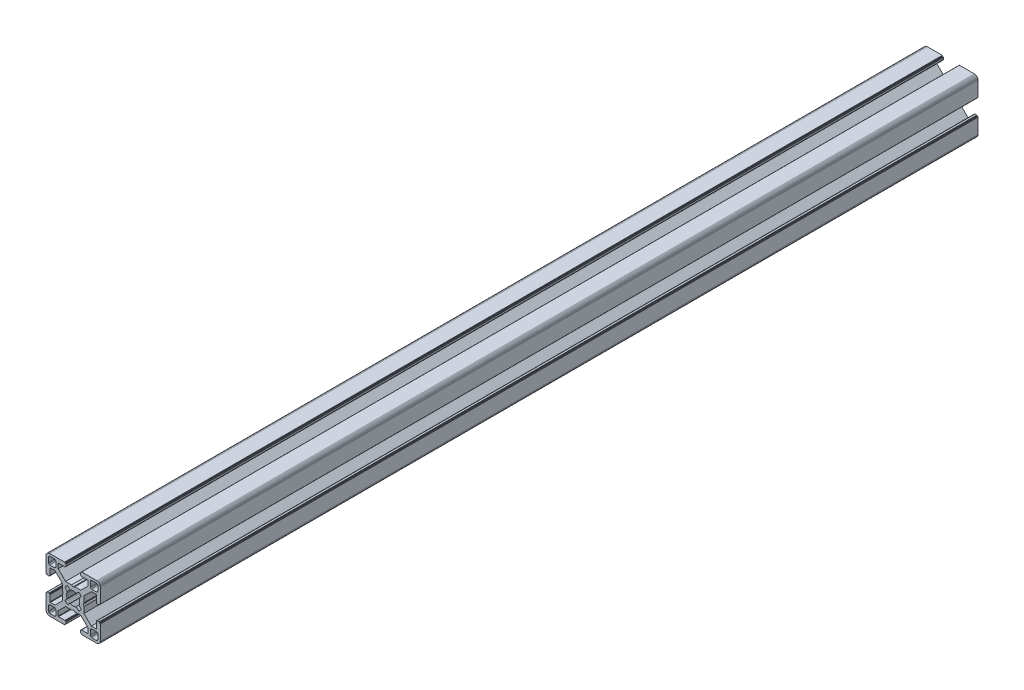
from build123d import *

# Parameters (mm, degrees)
BOSS_EXTRUDE1_DEPTH = 485


with BuildPart() as part:
    # Sketch1 → Boss-Extrude1 (new body)
    with BuildSketch(Plane.XY):
        Polygon((28.34729664, 29.969613999), (28.000000864, 29.999999329), (19.750000909, 29.999999329), (19.715268165, 29.996961355), (19.681595266, 29.987938702), (19.649999216, 29.973205179), (19.621443003, 29.953207821), (19.596790895, 29.928557575), (19.576793537, 29.899999499), (19.562061876, 29.868405312), (19.55303736, 29.834728688), (19.549999386, 29.799999669), (19.549999386, 29.699999839), (19.546961412, 29.665268958), (19.537936896, 29.631596059), (19.523203373, 29.599998146), (19.503207877, 29.571441934), (19.478557631, 29.546789825), (19.449999556, 29.526794329), (19.418403506, 29.512060806), (19.384728745, 29.503038153), (19.349999726, 29.500000179), (19.249999896, 29.500000179), (19.215267517, 29.496958527), (19.181592755, 29.487935874), (19.149996706, 29.47320235), (19.12143863, 29.453206855), (19.096788384, 29.428554746), (19.076791026, 29.399996671), (19.062057503, 29.368402484), (19.05303485, 29.334725859), (19.049996876, 29.299998703), (19.049996876, 28.39999837), (19.059110798, 28.29580945), (19.08618062, 28.194785165), (19.13038119, 28.099997016), (19.190369539, 28.014324653), (19.264324002, 27.94037019), (19.349996366, 27.88038184), (19.444784515, 27.836181271), (19.545806937, 27.809111449), (19.650010894, 27.799984574), (23.050010706, 27.799984574), (23.084741588, 27.7969466), (23.118414487, 27.787923946), (23.150012399, 27.773190423), (23.178568612, 27.753193065), (23.203220721, 27.728542819), (23.223218079, 27.699984744), (23.237949739, 27.668386831), (23.246974255, 27.634713932), (23.25001142, 27.59998608), (23.25001142, 25.049987618), (19.204474482, 20.999982084), (15.900007876, 20.999982084), (15.000008474, 20.48483404), (14.10000814, 20.999982084), (10.795543398, 20.999982084), (7.997342887, 23.801274731), (6.750011387, 25.049984589), (6.750011387, 27.599983051), (6.753049362, 27.634713932), (6.762072946, 27.668386831), (6.776805538, 27.699984744), (6.796801965, 27.728542819), (6.821454073, 27.753193065), (6.850011218, 27.773190423), (6.881607267, 27.787923946), (6.915282029, 27.7969466), (6.950011048, 27.799984574), (10.350011791, 27.799984574), (10.45420071, 27.809098497), (10.555223133, 27.836168318), (10.650011282, 27.880368888), (10.735683645, 27.940357238), (10.809638108, 28.014311701), (10.869626458, 28.099984064), (10.913827027, 28.194772213), (10.940895918, 28.295796498), (10.950010772, 28.399985417), (10.950010772, 29.299985751), (10.946974575, 29.334739239), (10.93795065, 29.368415522), (10.923215933, 29.400009153), (10.903218427, 29.428566473), (10.878566319, 29.45321765), (10.849999264, 29.473204166), (10.818403214, 29.487937689), (10.784728453, 29.496960342), (10.749999434, 29.500000179), (10.649999604, 29.500000179), (10.615270585, 29.503038153), (10.581595823, 29.512060806), (10.549999774, 29.526794329), (10.521441698, 29.546789825), (10.496791452, 29.571441934), (10.476795025, 29.599998146), (10.462061502, 29.631596059), (10.453037918, 29.665268958), (10.449999943, 29.699999839), (10.449999943, 29.799999669), (10.446961969, 29.834728688), (10.437938385, 29.868405312), (10.423205793, 29.899999499), (10.403208435, 29.928557575), (10.378557257, 29.953207821), (10.350000113, 29.973205179), (10.318404064, 29.987938702), (10.284729302, 29.996961355), (10.250000283, 29.999999329), (1.999999397, 29.999999329), (1.652702689, 29.969613999), (1.315958682, 29.879383743), (0.999999233, 29.732050374), (0.714424066, 29.532089829), (0.467910431, 29.285576195), (0.267948955, 28.999999166), (0.120614655, 28.684040532), (0.030384399, 28.34729664), (0, 28.000000864), (0, 19.750000909), (0.003037974, 19.715268165), (0.012061559, 19.681595266), (0.026795082, 19.649999216), (0.046790577, 19.621441141), (0.071442686, 19.596789032), (0.09999983, 19.576793537), (0.13159588, 19.562060013), (0.165270641, 19.55303736), (0.19999966, 19.549999386), (0.299999461, 19.549999386), (0.334728509, 19.546959549), (0.368403242, 19.537936896), (0.399999321, 19.523203373), (0.428556465, 19.503207877), (0.453208573, 19.478555769), (0.473204069, 19.449997693), (0.487937592, 19.418403506), (0.496961176, 19.384728745), (0.499999151, 19.349999726), (0.499999151, 19.249998033), (0.503038056, 19.215269014), (0.512060709, 19.181594253), (0.526794232, 19.150000066), (0.546790194, 19.121441524), (0.571441837, 19.096789882), (0.60000029, 19.076794925), (0.631595686, 19.062061999), (0.665270619, 19.053039982), (0.700000626, 19.050000801), (1.60000096, 19.050000801), (1.704189879, 19.059116587), (1.805213233, 19.086186409), (1.90000045, 19.130385115), (1.985673745, 19.190375328), (2.059627277, 19.264327928), (2.119616325, 19.350002154), (2.163816196, 19.444788441), (2.190886018, 19.545812726), (2.200000872, 19.650001645), (2.200000872, 23.050001457), (2.203039777, 23.084732338), (2.212062431, 23.118405237), (2.226795954, 23.15000315), (2.246792381, 23.178559362), (2.271443558, 23.203211471), (2.300000702, 23.223206967), (2.331596752, 23.23794049), (2.365271513, 23.246965006), (2.400001464, 23.250001117), (4.950000857, 23.250001117), (7.997332093, 20.202670812), (8.995535423, 19.204467788), (8.995535423, 15.900001182), (9.515148227, 15.00000178), (8.995535423, 14.100002378), (8.995535423, 10.795536704), (4.950000857, 6.750002138), (2.400001464, 6.750002138), (2.365271513, 6.753040112), (2.331596752, 6.762063697), (2.300000702, 6.77679722), (2.271443558, 6.796793647), (2.246792381, 6.821444824), (2.226795954, 6.850001968), (2.212062431, 6.881598018), (2.203039777, 6.915272779), (2.200000872, 6.950002729), (2.200000872, 10.350002542), (2.190896812, 10.454174265), (2.16382699, 10.555197618), (2.119627119, 10.649984836), (2.059638071, 10.735658131), (1.985684539, 10.809611663), (1.900011244, 10.869600944), (1.805224027, 10.913800582), (1.704200673, 10.940870404), (1.600011754, 10.949986189), (0.70001142, 10.949986189), (0.665281355, 10.946948596), (0.631606253, 10.937926283), (0.600010578, 10.923193954), (0.571451747, 10.903199537), (0.546799638, 10.87854836), (0.526794232, 10.850000195), (0.512060709, 10.818404146), (0.503038056, 10.784730315), (0.499999151, 10.750000365), (0.499999151, 10.650000535), (0.496961176, 10.615270585), (0.487937592, 10.581596754), (0.473204069, 10.550000705), (0.453208573, 10.521443561), (0.428556465, 10.496791452), (0.399999321, 10.476795956), (0.368403242, 10.462062433), (0.334728509, 10.453038849), (0.299999461, 10.449999943), (0.19999966, 10.449999943), (0.165270641, 10.446961969), (0.13159588, 10.437939316), (0.09999983, 10.423205793), (0.071442686, 10.403209366), (0.046790577, 10.378558189), (0.026795082, 10.350000113), (0.012061559, 10.318404064), (0.003037974, 10.284729302), (0, 10.250000283), (0, 1.999999397), (0.030384399, 1.652702689), (0.120614655, 1.315958682), (0.267948955, 0.999999233), (0.467910431, 0.714424066), (0.714424066, 0.467910431), (0.999999233, 0.267948955), (1.315958682, 0.120614655), (1.652702689, 0.030384399), (1.999999397, 0), (10.250000283, 0), (10.284729302, 0.003037974), (10.318404064, 0.012061559), (10.350000113, 0.026795082), (10.378557257, 0.046790577), (10.403208435, 0.071442686), (10.423205793, 0.09999983), (10.437938385, 0.13159588), (10.446961969, 0.165270641), (10.449999943, 0.19999966), (10.449999943, 0.300000422), (10.453037918, 0.334729441), (10.462061502, 0.368404202), (10.476795025, 0.400000252), (10.496791452, 0.428557396), (10.521441698, 0.453208573), (10.549999774, 0.473205), (10.581595823, 0.487938523), (10.615270585, 0.496961176), (10.649999604, 0.500000082), (10.749999434, 0.500000082), (10.784728453, 0.503038056), (10.818403214, 0.512060709), (10.849999264, 0.526794232), (10.878547894, 0.546800104), (10.903198606, 0.571451747), (10.923194493, 0.6000102), (10.93792742, 0.631606528), (10.946949437, 0.66528146), (10.950010772, 0.699984975), (10.950010772, 1.599985308), (10.940895918, 1.704174228), (10.913827027, 1.805197581), (10.869626458, 1.89998573), (10.809638108, 1.985658094), (10.735683645, 2.059612557), (10.650011282, 2.119600674), (10.555223133, 2.163801476), (10.45420071, 2.190870367), (10.350011791, 2.199985221), (6.950011048, 2.199985221), (6.915282029, 2.203024126), (6.881607267, 2.212046779), (6.850011218, 2.226780302), (6.821454073, 2.246776729), (6.796801965, 2.271427907), (6.776805538, 2.299985982), (6.762072946, 2.331582032), (6.753049362, 2.365256793), (6.750011387, 2.399985812), (6.750011387, 4.949985206), (9.787457566, 7.990785077), (10.795545277, 8.999985833), (14.100010019, 8.999985833), (15.000010353, 9.515133877), (15.900009756, 8.999985833), (19.204476361, 8.999985833), (20.21256413, 7.990786065), (23.25001142, 4.949988235), (23.25001142, 2.399988841), (23.246974255, 2.365256793), (23.237949739, 2.331582032), (23.223218079, 2.299985982), (23.203220721, 2.271427907), (23.178568612, 2.246776729), (23.150012399, 2.226780302), (23.118414487, 2.212046779), (23.084741588, 2.203024126), (23.050010706, 2.199985221), (19.650010894, 2.199985221), (19.545806937, 2.190883319), (19.444784515, 2.163814428), (19.349996366, 2.119613626), (19.264324002, 2.059625509), (19.190369539, 1.985671046), (19.13038119, 1.899998682), (19.08618062, 1.805210533), (19.059110798, 1.70418718), (19.049996876, 1.599998261), (19.049996876, 0.699997927), (19.053035506, 0.665268966), (19.062058795, 0.631594374), (19.076792915, 0.599998603), (19.096790813, 0.571440905), (19.121441524, 0.546790194), (19.149999978, 0.526794306), (19.181596306, 0.51206138), (19.215271238, 0.503039363), (19.249999896, 0.500000082), (19.349999726, 0.500000082), (19.384728745, 0.496961176), (19.418403506, 0.487938523), (19.449999556, 0.473205), (19.478557631, 0.453208573), (19.503207877, 0.428557396), (19.523203373, 0.400000252), (19.537936896, 0.368404202), (19.546961412, 0.334729441), (19.549999386, 0.300000422), (19.549999386, 0.19999966), (19.55303736, 0.165270641), (19.562061876, 0.13159588), (19.576793537, 0.09999983), (19.596789964, 0.071441755), (19.621442072, 0.046789646), (19.649998285, 0.02679415), (19.681594335, 0.012060627), (19.715267234, 0.003037043), (19.750000909, 0), (28.000000864, 0), (28.34729664, 0.030384399), (28.684040532, 0.120614655), (28.999999166, 0.267948955), (29.285576195, 0.467910431), (29.532089829, 0.714424066), (29.732050374, 0.999999233), (29.879383743, 1.315958682), (29.969613999, 1.652702689), (29.999999329, 1.999999397), (29.999999329, 10.250000283), (29.996974806, 10.284715361), (29.987951516, 10.318389952), (29.973217396, 10.349985723), (29.953219499, 10.378543421), (29.928568787, 10.403194133), (29.899999499, 10.423205793), (29.868405312, 10.437939316), (29.834728688, 10.446961969), (29.799999669, 10.449999943), (29.699999839, 10.449999943), (29.664909937, 10.453400043), (29.631233313, 10.462423628), (29.599637263, 10.477157151), (29.57108105, 10.497152646), (29.546427079, 10.521804755), (29.526433446, 10.550361899), (29.511699923, 10.581957949), (29.502675407, 10.615631779), (29.499637433, 10.650361729), (29.499637433, 10.750361559), (29.49697202, 10.784715548), (29.487949367, 10.818389378), (29.473215844, 10.849985428), (29.453220348, 10.878542572), (29.428568239, 10.90319468), (29.400010164, 10.923190176), (29.368415977, 10.937923699), (29.334741215, 10.946947284), (29.300012197, 10.949986189), (28.400011863, 10.949986189), (28.29581215, 10.9408876), (28.194787865, 10.913817778), (28.099999716, 10.86961814), (28.014327352, 10.809628859), (27.940374752, 10.735675327), (27.880384539, 10.650002032), (27.836185833, 10.555214814), (27.809114148, 10.454191461), (27.800000225, 10.350002542), (27.800000225, 6.950002729), (27.796962251, 6.915272779), (27.787939598, 6.881598018), (27.773206075, 6.850001968), (27.753208716, 6.821444824), (27.728558471, 6.796793647), (27.700000395, 6.77679722), (27.668404345, 6.762063697), (27.634729584, 6.753040112), (27.599998702, 6.750002138), (25.05000024, 6.750002138), (23.809199132, 7.99080223), (21.004464477, 10.795534588), (21.004464477, 14.100000262), (20.484851673, 14.999999665), (21.004464477, 15.899999067), (21.004464477, 19.204465672), (25.05000024, 23.250001117), (27.599998702, 23.250001117), (27.634729584, 23.246965006), (27.668404345, 23.23794049), (27.700000395, 23.223206967), (27.728558471, 23.203211471), (27.753208716, 23.178559362), (27.773206075, 23.15000315), (27.787939598, 23.118405237), (27.796962251, 23.084732338), (27.800000225, 23.050001457), (27.800000225, 19.650001645), (27.809114148, 19.545812726), (27.836185833, 19.444788441), (27.880384539, 19.350002154), (27.940370508, 19.264323684), (28.014323108, 19.190371084), (28.099995472, 19.130380872), (28.194783621, 19.086182165), (28.295807906, 19.059112343), (28.400001069, 19.050000801), (29.300001402, 19.050000801), (29.334730421, 19.053040638), (29.368405183, 19.062063291), (29.39999937, 19.076796814), (29.42819671, 19.097149726), (29.452848353, 19.1218023), (29.472843309, 19.150360754), (29.487576235, 19.181955219), (29.496598252, 19.215630151), (29.499637433, 19.250359227), (29.499637433, 19.35036092), (29.502675407, 19.385089939), (29.511699923, 19.4187647), (29.526433446, 19.450358887), (29.546427079, 19.478916963), (29.57108105, 19.503569071), (29.599637263, 19.523564567), (29.631233313, 19.53829809), (29.664909937, 19.547320743), (29.699999839, 19.549999386), (29.799999669, 19.549999386), (29.834728688, 19.55303736), (29.868405312, 19.562060013), (29.899999499, 19.576793537), (29.928557575, 19.596789032), (29.953207821, 19.621441141), (29.973205179, 19.649999216), (29.987938702, 19.681595266), (29.996961355, 19.715268165), (29.999999329, 19.750000909), (29.999999329, 28.000000864), (29.969613999, 28.34729664), (29.879383743, 28.684040532), (29.732050374, 28.999999166), (29.532089829, 29.285576195), (29.285576195, 29.532089829), (28.999999166, 29.732050374), (28.684040532, 29.879383743), align=None)
        Polygon((1.299998723, 25.499999523), (1.299998723, 27.699999511), (1.312309876, 27.856435627), (1.348942518, 28.009016067), (1.408992335, 28.153989464), (1.490981318, 28.287785128), (1.592892222, 28.407108039), (1.71221327, 28.50901708), (1.846008119, 28.591006994), (1.9909814, 28.651056811), (2.143563703, 28.687689453), (2.299998887, 28.699999675), (4.499998875, 28.699999675), (4.656434059, 28.687689453), (4.809016362, 28.651056811), (4.953989759, 28.591006994), (5.087784491, 28.50901708), (5.207106471, 28.407108039), (5.309016444, 28.287785128), (5.391005427, 28.153989464), (5.451056175, 28.009016067), (5.487687886, 27.856435627), (5.499999039, 27.699999511), (5.499999039, 25.499999523), (5.487687886, 25.34356527), (5.451056175, 25.190982968), (5.391005427, 25.04600957), (5.309016444, 24.912213907), (5.207106471, 24.792892858), (5.087784491, 24.690981954), (4.953989759, 24.60899204), (4.809016362, 24.548944086), (4.656434059, 24.512309581), (4.499998875, 24.499999359), (2.299998887, 24.499999359), (2.143563703, 24.512309581), (1.9909814, 24.548944086), (1.846008119, 24.60899204), (1.71221327, 24.690981954), (1.592892222, 24.792892858), (1.490981318, 24.912213907), (1.408992335, 25.04600957), (1.348942518, 25.190982968), (1.312309876, 25.34356527), align=None, mode=Mode.SUBTRACT)
        Polygon((25.34356527, 28.687689453), (25.499999523, 28.699999675), (27.699999511, 28.699999675), (27.856435627, 28.687689453), (28.009017929, 28.651056811), (28.153991327, 28.591006994), (28.28778699, 28.50901708), (28.407108039, 28.407108039), (28.50901708, 28.287785128), (28.591006994, 28.153989464), (28.651056811, 28.009016067), (28.687689453, 27.856435627), (28.700001538, 27.699999511), (28.700001538, 25.499999523), (28.687689453, 25.34356527), (28.651056811, 25.190982968), (28.591006994, 25.04600957), (28.50901708, 24.912213907), (28.407108039, 24.792892858), (28.28778699, 24.690981954), (28.153991327, 24.60899204), (28.009017929, 24.548944086), (27.856435627, 24.512309581), (27.699999511, 24.499999359), (25.499999523, 24.499999359), (25.34356527, 24.512309581), (25.190982968, 24.548944086), (25.04600957, 24.60899204), (24.912215769, 24.690981954), (24.792892858, 24.792892858), (24.690981954, 24.912213907), (24.608993903, 25.04600957), (24.548944086, 25.190982968), (24.512311444, 25.34356527), (24.500001222, 25.499999523), (24.500001222, 27.699999511), (24.512311444, 27.856435627), (24.548944086, 28.009016067), (24.608993903, 28.153989464), (24.690981954, 28.287785128), (24.792892858, 28.407108039), (24.912215769, 28.50901708), (25.04600957, 28.591006994), (25.190982968, 28.651056811), align=None, mode=Mode.SUBTRACT)
        Polygon((14.999999665, 18.649999052), (15.550030395, 18.608318642), (16.087498516, 18.484227359), (16.600128263, 18.280562013), (18.13592948, 19.518401474), (18.644984812, 19.11874488), (19.103571773, 18.662061542), (19.505336881, 18.154669553), (18.280562013, 16.600130126), (18.484227359, 16.087498516), (18.608318642, 15.550030395), (18.649999052, 14.999999665), (18.608318642, 14.449968934), (18.484227359, 13.912500814), (18.280562013, 13.399870135), (19.505336881, 11.845329776), (19.103571773, 11.337937787), (18.644984812, 10.881252587), (18.13592948, 10.481598787), (16.600128263, 11.719437316), (16.087498516, 11.515771039), (15.550030395, 11.391680688), (14.999999665, 11.349999346), (14.449968934, 11.391680688), (13.912500814, 11.515771039), (13.399870135, 11.719437316), (11.864069849, 10.481598787), (11.355013587, 10.881252587), (10.896427557, 11.337937787), (10.494662449, 11.845329776), (11.719438247, 13.399870135), (11.515771039, 13.912500814), (11.391680688, 14.449968934), (11.349999346, 14.999999665), (11.391680688, 15.550030395), (11.515771039, 16.087498516), (11.719438247, 16.600130126), (10.494662449, 18.154669553), (10.896427557, 18.662061542), (11.355013587, 19.11874488), (11.864069849, 19.518401474), (13.399870135, 18.280562013), (13.912500814, 18.484227359), (14.449968934, 18.608318642), align=None, mode=Mode.SUBTRACT)
        Polygon((4.499998875, 1.299999771), (2.299998887, 1.299999771), (2.143563703, 1.312310807), (1.9909814, 1.348942518), (1.846008119, 1.408992335), (1.71221327, 1.490982249), (1.592892222, 1.592892222), (1.490981318, 1.712214202), (1.408992335, 1.846008934), (1.348942518, 1.990982331), (1.312309876, 2.143564634), (1.299998723, 2.299998887), (1.299998723, 4.499999806), (1.312309876, 4.656434059), (1.348942518, 4.809017293), (1.408992335, 4.95399069), (1.490981318, 5.087785423), (1.592892222, 5.207106471), (1.71221327, 5.309017375), (1.846008119, 5.391006358), (1.9909814, 5.451056175), (2.143563703, 5.487688817), (2.299998887, 5.49999997), (4.499998875, 5.49999997), (4.656434059, 5.487688817), (4.809016362, 5.451056175), (4.953989759, 5.391006358), (5.087784491, 5.309017375), (5.207106471, 5.207106471), (5.309016444, 5.087785423), (5.391005427, 4.95399069), (5.451056175, 4.809017293), (5.487687886, 4.656434059), (5.499999039, 4.499999806), (5.499999039, 2.299998887), (5.487687886, 2.143564634), (5.451056175, 1.990982331), (5.391005427, 1.846008934), (5.309016444, 1.712214202), (5.207106471, 1.592892222), (5.087784491, 1.490982249), (4.953989759, 1.408992335), (4.809016362, 1.348942518), (4.656434059, 1.312310807), align=None, mode=Mode.SUBTRACT)
        Polygon((27.699999511, 1.299999771), (25.499999523, 1.299999771), (25.34356527, 1.312310807), (25.190982968, 1.348942518), (25.04600957, 1.408992335), (24.912215769, 1.490982249), (24.792892858, 1.592892222), (24.690981954, 1.712214202), (24.608993903, 1.846008934), (24.548944086, 1.990982331), (24.512311444, 2.143564634), (24.500001222, 2.299998887), (24.500001222, 4.499999806), (24.512311444, 4.656434059), (24.548944086, 4.809017293), (24.608993903, 4.95399069), (24.690981954, 5.087785423), (24.792892858, 5.207106471), (24.912215769, 5.309017375), (25.04600957, 5.391006358), (25.190982968, 5.451056175), (25.34356527, 5.487688817), (25.499999523, 5.49999997), (27.699999511, 5.49999997), (27.856435627, 5.487688817), (28.009017929, 5.451056175), (28.153991327, 5.391006358), (28.28778699, 5.309017375), (28.407108039, 5.207106471), (28.50901708, 5.087785423), (28.591006994, 4.95399069), (28.651056811, 4.809017293), (28.687689453, 4.656434059), (28.700001538, 4.499999806), (28.700001538, 2.299998887), (28.687689453, 2.143564634), (28.651056811, 1.990982331), (28.591006994, 1.846008934), (28.50901708, 1.712214202), (28.407108039, 1.592892222), (28.28778699, 1.490982249), (28.153991327, 1.408992335), (28.009017929, 1.348942518), (27.856435627, 1.312310807), align=None, mode=Mode.SUBTRACT)
    extrude(amount=-BOSS_EXTRUDE1_DEPTH)


solid = part.part
